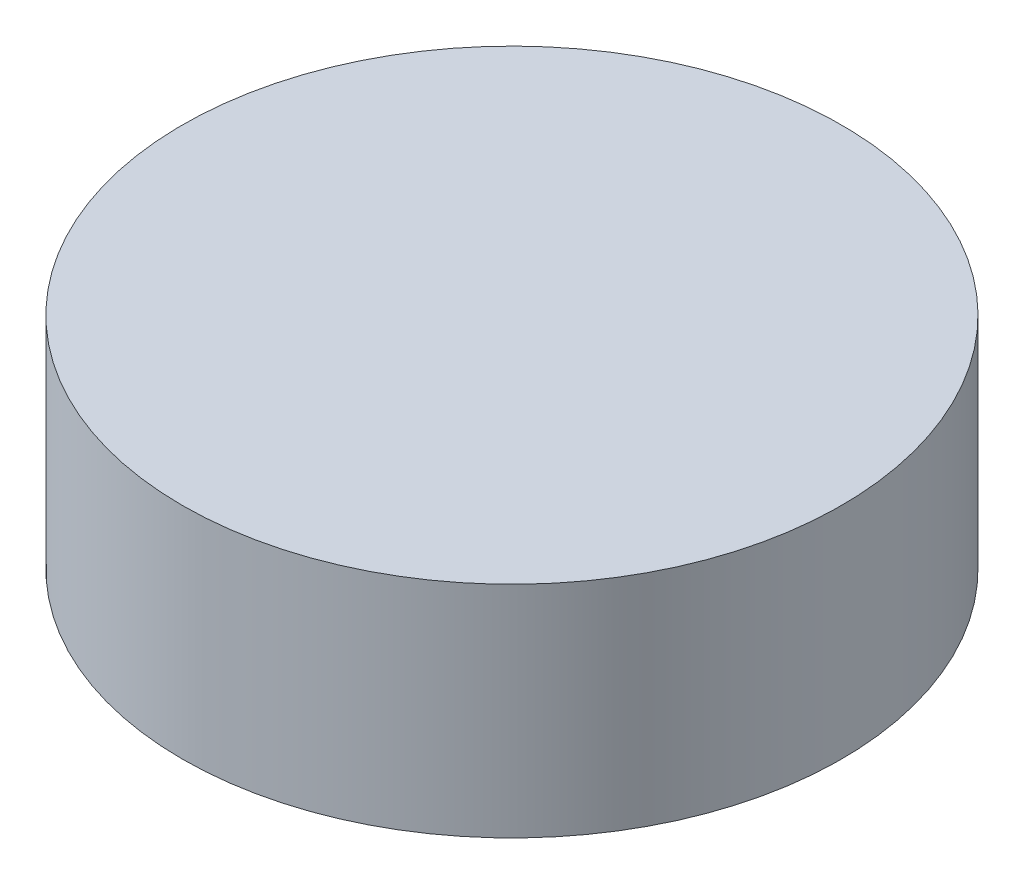
from build123d import *

# Parameters (mm, degrees)
SKETCH1_R           = 45
BOSS_EXTRUDE1_DEPTH = 30


with BuildPart() as part:
    # Sketch1 → Boss-Extrude1 (new body)
    with BuildSketch(Plane(origin=(0, 0, 0), x_dir=(1, 0, 0), z_dir=(0, 1, 0))):
        Circle(SKETCH1_R)
    extrude(amount=BOSS_EXTRUDE1_DEPTH)


solid = part.part
